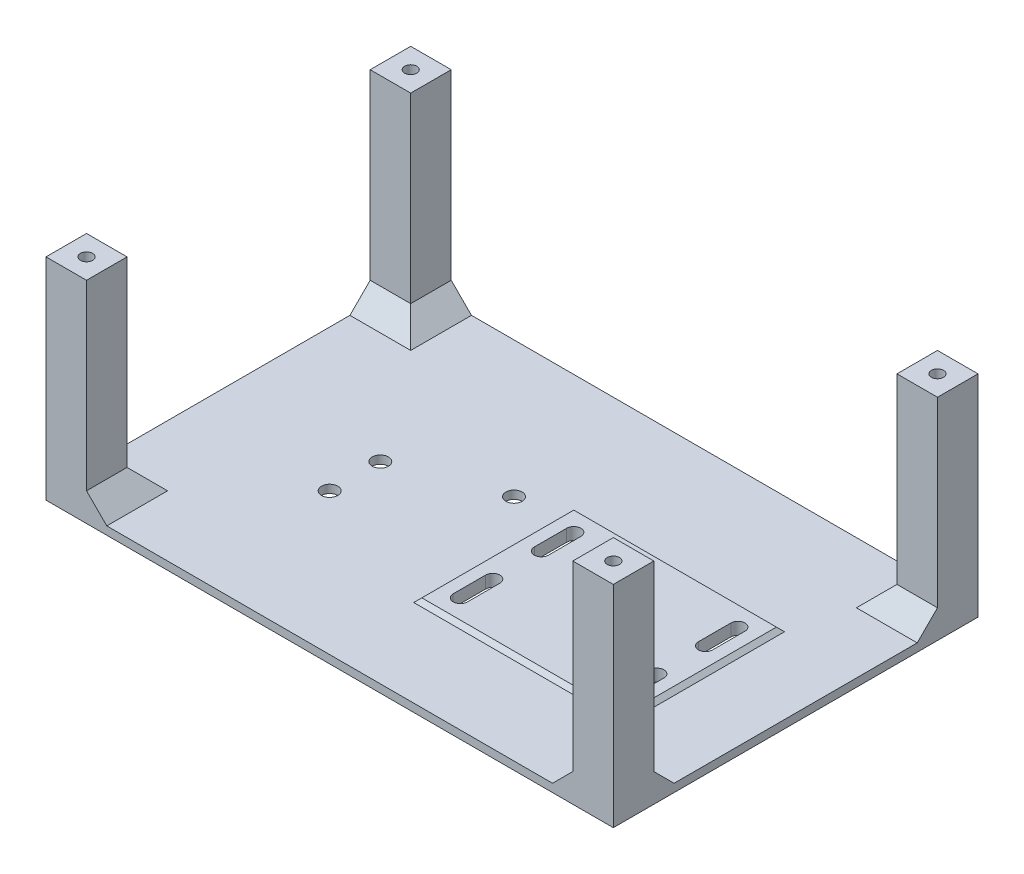
from build123d import *

# Parameters (mm, degrees)
SKETCH1_W           = 140
SKETCH1_H           = 90
BOSS_EXTRUDE1_DEPTH = 2
SKETCH2_R           = 2
CUT_EXTRUDE1_DEPTH  = 84.240615087
SKETCH3_R           = 1.75
CUT_EXTRUDE2_DEPTH  = 84.240615087
SKETCH4_W           = 10
SKETCH4_H           = 10
BOSS_EXTRUDE2_DEPTH = 50
CHAMFER1_SIZE       = 5
SKETCH6_R           = 1.5
CUT_EXTRUDE3_DEPTH  = 99.127468122
CUT_EXTRUDE4_DEPTH  = 98.082439195
BOSS_EXTRUDE3_START = 1
SKETCH8_W           = 50
SKETCH8_H           = 37.5
BOSS_EXTRUDE3_DEPTH = 1
CHAMFER2_SIZE       = 1


with BuildPart() as part:
    # Sketch1 → Boss-Extrude1 (new body)
    with BuildSketch(Plane(origin=(0, 0, 0), x_dir=(1, 0, 0), z_dir=(0, 1, 0))):
        Rectangle(SKETCH1_W, SKETCH1_H)
    extrude(amount=BOSS_EXTRUDE1_DEPTH)

    # Sketch2 → Cut-Extrude1 (cut, through all)
    with BuildSketch(Plane(origin=(0, 2, 0), x_dir=(1, 0, 0), z_dir=(0, 1, 0))):
        with Locations(Location((-35, -10, 0), (0, 0, 270))):
            Circle(SKETCH2_R)
        with Locations(Location((-35, 2.5, 0), (0, 0, 270))):
            Circle(SKETCH2_R)
        with Locations(Location((-11, 11.5, 0), (0, 0, 270))):
            Circle(SKETCH2_R)
    extrude(amount=-CUT_EXTRUDE1_DEPTH, mode=Mode.SUBTRACT)

    # Sketch3 → Cut-Extrude2 (cut, through all)
    with BuildSketch(Plane(origin=(0, 2, 0), x_dir=(1, 0, 0), z_dir=(0, 1, 0))):
        with Locations(Location((45.5, 6.25, 0), (0, 0, 270))):
            Circle(SKETCH3_R)
        with Locations(Location((45.5, -13.75, 0), (0, 0, 270))):
            Circle(SKETCH3_R)
        with Locations(Location((5, 6.25, 0), (0, 0, 270))):
            Circle(SKETCH3_R)
        with Locations(Location((5, -13.75, 0), (0, 0, 270))):
            Circle(SKETCH3_R)
    extrude(amount=-CUT_EXTRUDE2_DEPTH, mode=Mode.SUBTRACT)

    # Sketch4 → Boss-Extrude2 (add)
    with BuildSketch(Plane(origin=(0, 2, 0), x_dir=(1, 0, 0), z_dir=(0, 1, 0))):
        with Locations((-65, 40)):
            Rectangle(SKETCH4_W, SKETCH4_H)
        with Locations((65, 40)):
            Rectangle(SKETCH4_W, SKETCH4_H)
        with Locations((65, -40)):
            Rectangle(SKETCH4_W, SKETCH4_H)
        with Locations((-65, -40)):
            Rectangle(SKETCH4_W, SKETCH4_H)
    extrude(amount=BOSS_EXTRUDE2_DEPTH)

    # Chamfer1
    chamfer1_edges = [part.edges().sort_by_distance(p)[0] for p in [
        (-65, 2, -35),
        (-60, 2, -40),
        (60, 2, -40),
        (65, 2, -35),
        (65, 2, 35),
        (60, 2, 40),
        (-60, 2, 40),
        (-65, 2, 35),
    ]]
    chamfer(chamfer1_edges, length=CHAMFER1_SIZE)

    # Sketch6 → Cut-Extrude3 (cut, through all)
    with BuildSketch(Plane(origin=(0, 52, 0), x_dir=(1, 0, 0), z_dir=(0, 1, 0))):
        with Locations(Location((-65, 40, 0), (0, 0, 270))):
            Circle(SKETCH6_R)
        with Locations(Location((65, 40, 0), (0, 0, 270))):
            Circle(SKETCH6_R)
        with Locations(Location((65, -40, 0), (0, 0, 270))):
            Circle(SKETCH6_R)
        with Locations(Location((-65, -40, 0), (0, 0, 270))):
            Circle(SKETCH6_R)
    extrude(amount=-CUT_EXTRUDE3_DEPTH, mode=Mode.SUBTRACT)

    # Sketch7 → Cut-Extrude4 (cut, through all)
    with BuildSketch(Plane(origin=(0, 2, 0), x_dir=(1, 0, 0), z_dir=(0, 1, 0))):
        with BuildLine():
            Line((6.75, 10.25), (6.75, 2.25))
            ThreePointArc((6.75, 2.25), (5, 0.5), (3.25, 2.25))
            Line((3.25, 2.25), (3.25, 10.25))
            ThreePointArc((3.25, 10.25), (5, 12), (6.75, 10.25))
        make_face()
        with BuildLine():
            Line((47.25, 10.25), (47.25, 2.25))
            ThreePointArc((47.25, 2.25), (45.5, 0.5), (43.75, 2.25))
            Line((43.75, 2.25), (43.75, 10.25))
            ThreePointArc((43.75, 10.25), (45.5, 12), (47.25, 10.25))
        make_face()
        with BuildLine():
            Line((6.75, -9.75), (6.75, -17.75))
            ThreePointArc((6.75, -17.75), (5, -19.5), (3.25, -17.75))
            Line((3.25, -17.75), (3.25, -9.75))
            ThreePointArc((3.25, -9.75), (5, -8), (6.75, -9.75))
        make_face()
        with BuildLine():
            Line((43.75, -17.75), (43.75, -9.75))
            ThreePointArc((43.75, -9.75), (45.5, -8), (47.25, -9.75))
            Line((47.25, -9.75), (47.25, -17.75))
            ThreePointArc((47.25, -17.75), (45.5, -19.5), (43.75, -17.75))
        make_face()
    extrude(amount=-CUT_EXTRUDE4_DEPTH, mode=Mode.SUBTRACT)

    # Sketch8 → Boss-Extrude3 (add)
    with BuildSketch(Plane(origin=(0, 2, 0), x_dir=(1, 0, 0), z_dir=(0, 1, 0)).offset(BOSS_EXTRUDE3_START)):
        with Locations((25.25, -3.75)):
            Rectangle(SKETCH8_W, SKETCH8_H)
        with BuildLine():
            Line((47.25, 2.25), (47.25, 10.25))
            ThreePointArc((47.25, 10.25), (45.5, 12), (43.75, 10.25))
            Line((43.75, 10.25), (43.75, 2.25))
            ThreePointArc((43.75, 2.25), (45.5, 0.5), (47.25, 2.25))
        make_face(mode=Mode.SUBTRACT)
        with BuildLine():
            Line((3.25, 10.25), (3.25, 2.25))
            ThreePointArc((3.25, 2.25), (5, 0.5), (6.75, 2.25))
            Line((6.75, 2.25), (6.75, 10.25))
            ThreePointArc((6.75, 10.25), (5, 12), (3.25, 10.25))
        make_face(mode=Mode.SUBTRACT)
        with BuildLine():
            Line((47.25, -17.75), (47.25, -9.75))
            ThreePointArc((47.25, -9.75), (45.5, -8), (43.75, -9.75))
            Line((43.75, -9.75), (43.75, -17.75))
            ThreePointArc((43.75, -17.75), (45.5, -19.5), (47.25, -17.75))
        make_face(mode=Mode.SUBTRACT)
        with BuildLine():
            Line((3.25, -9.75), (3.25, -17.75))
            ThreePointArc((3.25, -17.75), (5, -19.5), (6.75, -17.75))
            Line((6.75, -17.75), (6.75, -9.75))
            ThreePointArc((6.75, -9.75), (5, -8), (3.25, -9.75))
        make_face(mode=Mode.SUBTRACT)
    extrude(amount=-BOSS_EXTRUDE3_DEPTH)

    # Chamfer2
    chamfer2_edges = [part.edges().sort_by_distance(p)[0] for p in [
        (50.25, 2, 3.75),
        (25.25, 2, -15),
        (0.25, 2, 3.75),
        (25.25, 2, 22.5),
    ]]
    chamfer(chamfer2_edges, length=CHAMFER2_SIZE - 0.0001)  # a hair under: the kernel refuses the full size


solid = part.part
